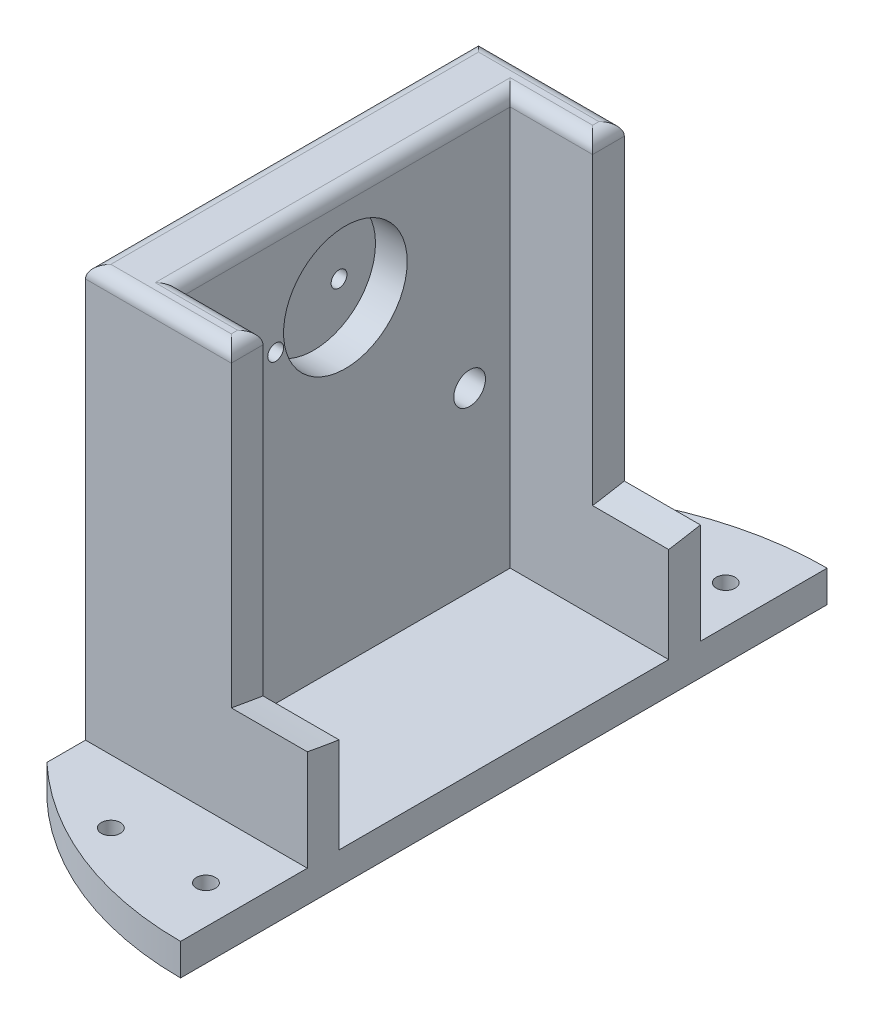
from build123d import *

# Parameters (mm, degrees)
BOSS_EXTRU_7_DEPTH      = 35
BOSS_EXTRU_8_DEPTH      = 5
ESQUISSE3_R             = 2.5
ENL_V_MAT_EXTRU_1_DEPTH = 5
ENL_V_MAT_EXTRU_2_DEPTH = 12
ESQUISSE6_R             = 9.75
ENL_V_MAT_EXTRU_3_DEPTH = 5
CONG_1_R                = 2
ESQUISSE8_R             = 1.5
ENL_V_MAT_EXTRU_5_DEPTH = 90.727364834
TROU_TARAUD_M31_D       = 2.5
TROU_TARAUD_M31_DEPTH   = 12.5
TROU_TARAUD_M31_TIP     = 0.751075774


with BuildPart() as part:
    # Esquisse1 → Boss.-Extru.7 (new, symmetric)
    with BuildSketch(Plane(origin=(0, 0, 0), x_dir=(1, 0, 0), z_dir=(0, 1, 0))):
        Polygon((-35, 31), (-35, -31), (0, -31), (0, -26), (-25, -26), (-25, -22.1), (-25, -17.1), (-25, 17.1), (-25, 22.1), (-25, 26), (0, 26), (0, 31), align=None)
    extrude(amount=BOSS_EXTRU_7_DEPTH, both=True)

    # Esquisse2 → Boss.-Extru.8 (add)
    with BuildSketch(Plane.XZ.offset(35)):
        with BuildLine():
            Line((-35, 37.094473982), (-35, -37.094473982))
            ThreePointArc((-35, -37.094473982), (-18.830584523, -47.396298237), (0, -51))
            Line((0, -51), (0, 51))
            ThreePointArc((0, 51), (-18.830584523, 47.396298237), (-35, 37.094473982))
        make_face()
    extrude(amount=-BOSS_EXTRU_8_DEPTH)

    # Esquisse3 → Enlèv. mat.-Extru.1 (cut)
    with BuildSketch(Plane(origin=(-25, 0, 0), x_dir=(0, 0, -1), z_dir=(1, 0, 0))):
        with Locations((-19.6, -2.21)):
            Circle(ESQUISSE3_R)
        with Locations((19.6, -2.21)):
            Circle(ESQUISSE3_R)
    extrude(amount=-ENL_V_MAT_EXTRU_1_DEPTH, mode=Mode.SUBTRACT)

    # Esquisse5 → Enlèv. mat.-Extru.2 (cut)
    with BuildSketch(Plane(origin=(0, 0, 0), x_dir=(0, 0, -1), z_dir=(1, 0, 0))):
        with BuildLine():
            Line((98.051206934, 14.815086571), (40.674477228, 51.032394683))
            ThreePointArc((40.674477228, 51.032394683), (34.260412481, 48.633219758), (27.706013605, 46.649253461))
            ThreePointArc((27.706013605, 46.649253461), (-0.631861598, 43.001865666), (-28.924683694, 46.983677637))
            ThreePointArc((-28.924683694, 46.983677637), (-34.858411147, 48.837303455), (-40.674477228, 51.032394683))
            Line((-40.674477228, 51.032394683), (-98.051206934, 14.815086571))
            ThreePointArc((-98.051206934, 14.815086571), (0, -17), (98.051206934, 14.815086571))
        make_face()
    extrude(amount=-ENL_V_MAT_EXTRU_2_DEPTH, mode=Mode.SUBTRACT)

    # Esquisse6 → Enlèv. mat.-Extru.3 (cut)
    with BuildSketch(Plane(origin=(-25, 0, 0), x_dir=(0, 0, -1), z_dir=(1, 0, 0))):
        with Locations((0, 20)):
            Circle(ESQUISSE6_R)
    extrude(amount=-ENL_V_MAT_EXTRU_3_DEPTH, mode=Mode.SUBTRACT)

    # Congé1
    cong_1_edges = [part.edges().sort_by_distance(p)[0] for p in [
        (-23.5, 35, -31),
        (-35, 35, 0),
        (-23.5, 35, 31),
        (-12, 35, -28.5),
        (-18.5, 35, -26),
        (-25, 35, 0),
        (-18.5, 35, 26),
        (-12, 35, 28.5),
    ]]
    fillet(cong_1_edges, radius=CONG_1_R)

    # Esquisse8 → Enlèv. mat.-Extru.5 (cut, through all)
    with BuildSketch(Plane(origin=(0, -30, 0), x_dir=(1, 0, 0), z_dir=(0, 1, 0))):
        with Locations((-21, 41)):
            Circle(ESQUISSE8_R)
        with Locations((-6, 41)):
            Circle(ESQUISSE8_R)
        with Locations((-6, -41)):
            Circle(ESQUISSE8_R)
        with Locations((-21, -41)):
            Circle(ESQUISSE8_R)
    extrude(amount=-ENL_V_MAT_EXTRU_5_DEPTH, mode=Mode.SUBTRACT)

    # Trou taraudé M31
    with Locations(Plane(origin=(-35, 18, -4), x_dir=(0, 0, -1), z_dir=(-1, 0, 0))):
        with Locations((0, 0), (-15, 0), (-30, 0)):
            Hole(TROU_TARAUD_M31_D / 2, depth=TROU_TARAUD_M31_DEPTH)
            with Locations((0, 0, -(TROU_TARAUD_M31_DEPTH + TROU_TARAUD_M31_TIP / 2))):  # 118° drill point
                Cone(0, TROU_TARAUD_M31_D / 2, TROU_TARAUD_M31_TIP, mode=Mode.SUBTRACT)


solid = part.part
